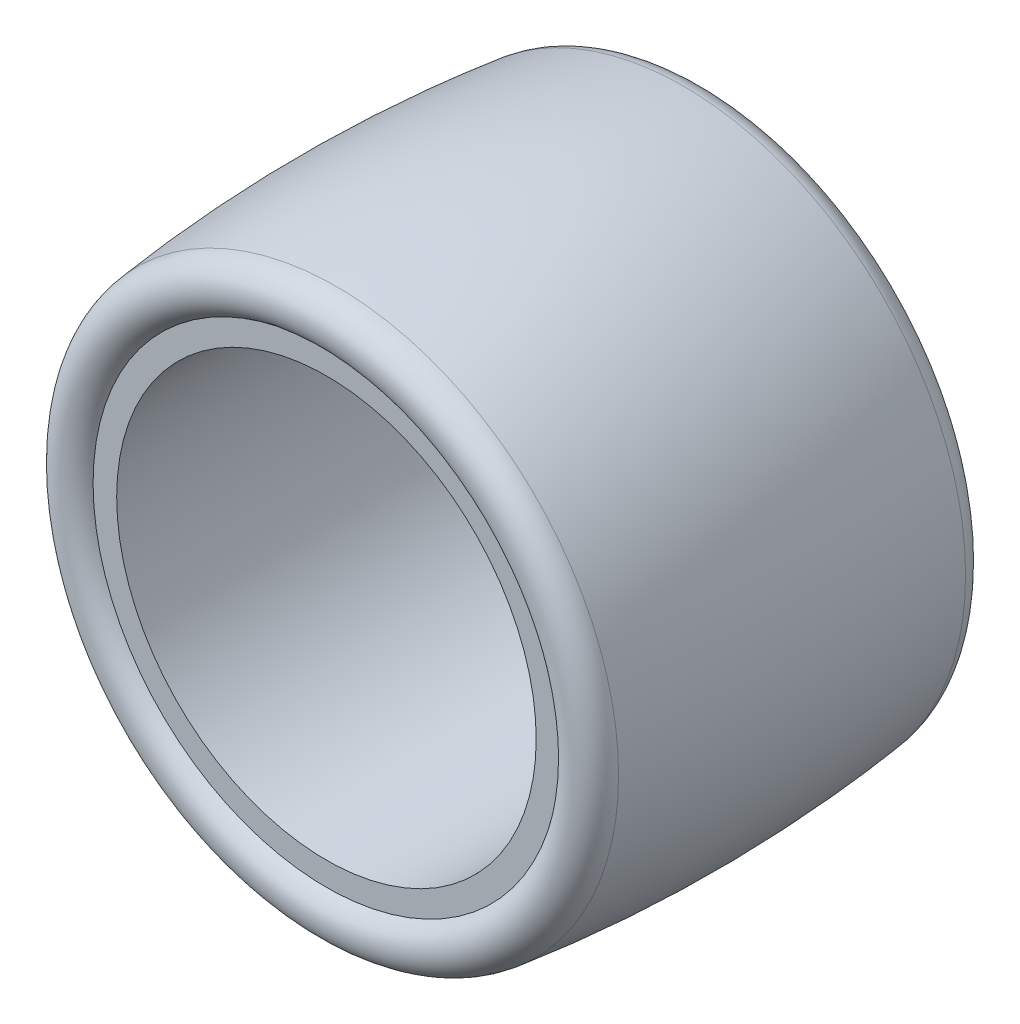
from build123d import *

# Parameters (mm, degrees)
SKETCH1_R           = 44.5
SKETCH1_R_2         = 40
BOSS_EXTRUDE1_DEPTH = 35


with BuildPart() as part:
    # Sketch1 → Boss-Extrude1 (new, symmetric)
    with BuildSketch(Plane.XY):
        Circle(SKETCH1_R)
        Circle(SKETCH1_R_2, mode=Mode.SUBTRACT)
    extrude(amount=BOSS_EXTRUDE1_DEPTH, both=True)

    # Sketch3 → Revolve1 (revolve)
    with BuildSketch(Plane(origin=(0, 0, 0), x_dir=(0, 0, -1), z_dir=(1, 0, 0))):
        with BuildLine():
            Line((-35, 44.5), (35, 44.5))
            ThreePointArc((35, 44.5), (37.397537405, 49.837165929), (33.088675892, 53.795352159))
            ThreePointArc((33.088675892, 53.795352159), (0, 55.75), (-33.088675892, 53.795352159))
            ThreePointArc((-33.088675892, 53.795352159), (-37.397537405, 49.837165929), (-35, 44.5))
        make_face()
    revolve(axis=Axis((0, 0, 49.815578233), (0, 0, -1)))


solid = part.part
